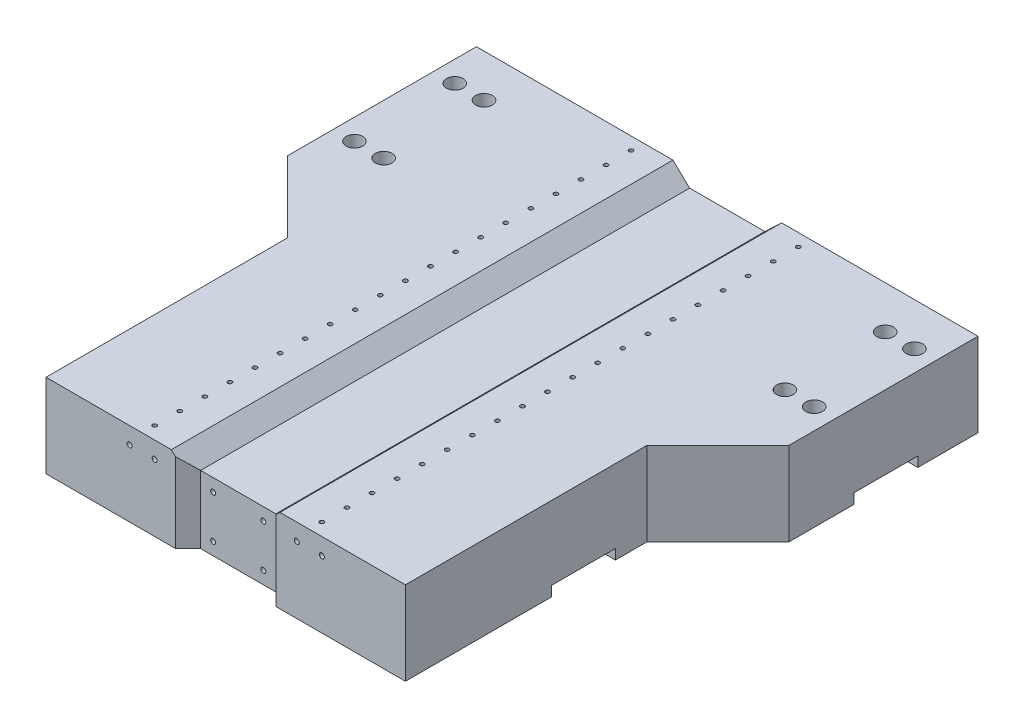
from build123d import *

# Parameters (mm, degrees)
SKETCH1_W                           = 600
SKETCH1_H                           = 600
BOSS_EXTRUDE1_DEPTH                 = 100
CUT_EXTRUDE1_DEPTH                  = 436.889894354
CHAMFER5_SIZE                       = 85
CUT_EXTRUDE2_DEPTH                  = 679.232998313
SKETCH9_R                           = 10
CUT_EXTRUDE5_DEPTH                  = 436.889894354
SKETCH12_R                          = 2.5
CUT_EXTRUDE7_DEPTH                  = 30
SKETCH14_W                          = 90
SKETCH14_H                          = 15
CUT_EXTRUDE8_DEPTH                  = 432.927077179
CHAMFER3_SIZE                       = 15
SKETCH15_W                          = 76.2
SKETCH15_H                          = 12.7
CUT_EXTRUDE9_DEPTH                  = 679.232998313
F_6_0MM_DOWEL_HOLE1_D               = 6
F_6_0MM_DOWEL_HOLE1_DEPTH           = 30
F_6_0MM_DOWEL_HOLE1_TIP             = 1.802581857
F_6_0MM_DOWEL_HOLE1_ON_FACE_2_D     = 6
F_6_0MM_DOWEL_HOLE1_ON_FACE_2_DEPTH = 30
F_6_0MM_DOWEL_HOLE1_ON_FACE_2_TIP   = 1.802581857
F_6_0MM_DOWEL_HOLE1_ON_FACE_3_D     = 6
F_6_0MM_DOWEL_HOLE1_ON_FACE_3_DEPTH = 30
F_6_0MM_DOWEL_HOLE1_ON_FACE_3_TIP   = 1.802581857


with BuildPart() as part:
    # Sketch1 → Boss-Extrude1 (new body)
    with BuildSketch(Plane(origin=(0, 0, 0), x_dir=(1, 0, 0), z_dir=(0, 1, 0))):
        Rectangle(SKETCH1_W, SKETCH1_H)
    extrude(amount=BOSS_EXTRUDE1_DEPTH)

    # Sketch2 → Cut-Extrude1 (cut, through all)
    with BuildSketch(Plane(origin=(0, 100, 0), x_dir=(1, 0, 0), z_dir=(0, 1, 0))):
        Polygon((-300, -300), (-220, -300), (-215, -300), (-215, 74), (-220, 74), (-300, 74), (-300, 60), align=None)
        Polygon((300, -300), (220, -300), (215, -300), (215, 74), (220, 74), (300, 74), (300, 60), align=None)
    extrude(amount=-CUT_EXTRUDE1_DEPTH, mode=Mode.SUBTRACT)

    # Chamfer5
    chamfer5_edges = [part.edges().sort_by_distance(p)[0] for p in [
        (-215, 50, -74),
        (215, 50, -74),
    ]]
    chamfer(chamfer5_edges, length=CHAMFER5_SIZE - 0.0001)  # a hair under: the kernel refuses the full size

    # Sketch3 → Cut-Extrude2 (cut, through all)
    with BuildSketch(Plane.XY.offset(300)):
        Polygon((-35, 81), (-45, 81), (-65, 100), (-45, 100), (45, 100), (65, 100), (45, 81), (35, 81), (0, 81), align=None)
    extrude(amount=-CUT_EXTRUDE2_DEPTH, mode=Mode.SUBTRACT)

    # Sketch9 → Cut-Extrude5 (cut, through all)
    with BuildSketch(Plane(origin=(0, 100, 0), x_dir=(1, 0, 0), z_dir=(0, 1, 0))):
        with Locations(Location((275, 129, 0), (0, 0, 270))):
            Circle(SKETCH9_R)
        with Locations(Location((240, 129, 0), (0, 0, 270))):
            Circle(SKETCH9_R)
        with Locations(Location((240, 249, 0), (0, 0, 270))):
            Circle(SKETCH9_R)
        with Locations(Location((275, 249, 0), (0, 0, 270))):
            Circle(SKETCH9_R)
        with Locations(Location((-275, 129, 0), (0, 0, 90))):
            Circle(SKETCH9_R)
        with Locations(Location((-240, 249, 0), (0, 0, 90))):
            Circle(SKETCH9_R)
        with Locations(Location((-275, 249, 0), (0, 0, 90))):
            Circle(SKETCH9_R)
        with Locations(Location((-240, 129, 0), (0, 0, 90))):
            Circle(SKETCH9_R)
    extrude(amount=-CUT_EXTRUDE5_DEPTH, mode=Mode.SUBTRACT)

    # Sketch12 → Cut-Extrude7 (cut)
    with BuildSketch(Plane(origin=(0, 100, 0), x_dir=(1, 0, 0), z_dir=(0, 1, 0))):
        with Locations(Location((-100, -285, 0), (0, 0, 270))):
            Circle(SKETCH12_R)
        with Locations(Location((100, -285, 0), (0, 0, 270))):
            Circle(SKETCH12_R)
        with Locations(Location((100, -255, 0), (0, 0, 270))):
            Circle(SKETCH12_R)
        with Locations(Location((100, -225, 0), (0, 0, 270))):
            Circle(SKETCH12_R)
        with Locations(Location((100, -195, 0), (0, 0, 270))):
            Circle(SKETCH12_R)
        with Locations(Location((100, -165, 0), (0, 0, 270))):
            Circle(SKETCH12_R)
        with Locations(Location((100, -135, 0), (0, 0, 270))):
            Circle(SKETCH12_R)
        with Locations(Location((100, -105, 0), (0, 0, 270))):
            Circle(SKETCH12_R)
        with Locations(Location((100, -75, 0), (0, 0, 270))):
            Circle(SKETCH12_R)
        with Locations(Location((100, -45, 0), (0, 0, 270))):
            Circle(SKETCH12_R)
        with Locations(Location((100, -15, 0), (0, 0, 270))):
            Circle(SKETCH12_R)
        with Locations(Location((100, 15, 0), (0, 0, 270))):
            Circle(SKETCH12_R)
        with Locations(Location((100, 45, 0), (0, 0, 270))):
            Circle(SKETCH12_R)
        with Locations(Location((100, 75, 0), (0, 0, 270))):
            Circle(SKETCH12_R)
        with Locations(Location((100, 105, 0), (0, 0, 270))):
            Circle(SKETCH12_R)
        with Locations(Location((100, 135, 0), (0, 0, 270))):
            Circle(SKETCH12_R)
        with Locations(Location((100, 165, 0), (0, 0, 270))):
            Circle(SKETCH12_R)
        with Locations(Location((100, 195, 0), (0, 0, 270))):
            Circle(SKETCH12_R)
        with Locations(Location((100, 225, 0), (0, 0, 270))):
            Circle(SKETCH12_R)
        with Locations(Location((100, 255, 0), (0, 0, 270))):
            Circle(SKETCH12_R)
        with Locations(Location((100, 285, 0), (0, 0, 270))):
            Circle(SKETCH12_R)
        with Locations(Location((-100, -255, 0), (0, 0, 270))):
            Circle(SKETCH12_R)
        with Locations(Location((-100, -225, 0), (0, 0, 270))):
            Circle(SKETCH12_R)
        with Locations(Location((-100, -195, 0), (0, 0, 270))):
            Circle(SKETCH12_R)
        with Locations(Location((-100, -165, 0), (0, 0, 270))):
            Circle(SKETCH12_R)
        with Locations(Location((-100, -135, 0), (0, 0, 270))):
            Circle(SKETCH12_R)
        with Locations(Location((-100, -105, 0), (0, 0, 270))):
            Circle(SKETCH12_R)
        with Locations(Location((-100, -75, 0), (0, 0, 270))):
            Circle(SKETCH12_R)
        with Locations(Location((-100, -45, 0), (0, 0, 270))):
            Circle(SKETCH12_R)
        with Locations(Location((-100, -15, 0), (0, 0, 270))):
            Circle(SKETCH12_R)
        with Locations(Location((-100, 15, 0), (0, 0, 270))):
            Circle(SKETCH12_R)
        with Locations(Location((-100, 45, 0), (0, 0, 270))):
            Circle(SKETCH12_R)
        with Locations(Location((-100, 75, 0), (0, 0, 270))):
            Circle(SKETCH12_R)
        with Locations(Location((-100, 105, 0), (0, 0, 270))):
            Circle(SKETCH12_R)
        with Locations(Location((-100, 135, 0), (0, 0, 270))):
            Circle(SKETCH12_R)
        with Locations(Location((-100, 165, 0), (0, 0, 270))):
            Circle(SKETCH12_R)
        with Locations(Location((-100, 195, 0), (0, 0, 270))):
            Circle(SKETCH12_R)
        with Locations(Location((-100, 225, 0), (0, 0, 270))):
            Circle(SKETCH12_R)
        with Locations(Location((-100, 255, 0), (0, 0, 270))):
            Circle(SKETCH12_R)
        with Locations(Location((-100, 285, 0), (0, 0, 270))):
            Circle(SKETCH12_R)
    extrude(amount=-CUT_EXTRUDE7_DEPTH, mode=Mode.SUBTRACT)

    # Sketch14 → Cut-Extrude8 (cut, through all)
    with BuildSketch(Plane(origin=(0, 81, 0), x_dir=(1, 0, 0), z_dir=(0, 1, 0))):
        with Locations((0, -292.5)):
            Rectangle(SKETCH14_W, SKETCH14_H)
    extrude(amount=-CUT_EXTRUDE8_DEPTH, mode=Mode.SUBTRACT)

    # Chamfer3
    chamfer3_edges = [part.edges().sort_by_distance(p)[0] for p in [
        (45, 40.5, 300),
        (-45, 40.5, 300),
    ]]
    chamfer(chamfer3_edges, length=CHAMFER3_SIZE - 0.0001)  # a hair under: the kernel refuses the full size

    # Sketch15 → Cut-Extrude9 (cut, through all)
    with BuildSketch(Plane.ZY.offset(300)):
        with Locations((86.9, 5.65)):
            Rectangle(SKETCH15_W, SKETCH15_H)
        with Locations((-189.9, 5.65)):
            Rectangle(SKETCH15_W, SKETCH15_H)
    extrude(amount=-CUT_EXTRUDE9_DEPTH, mode=Mode.SUBTRACT)

    # Ø6.0mm Dowel Hole1
    with Locations(Plane(origin=(-30, 66, 285), x_dir=(1, 0, 0), z_dir=(0, 0, 1))):
        with Locations((0, 0), (60, 0), (60, -51), (0, -51)):
            Hole(F_6_0MM_DOWEL_HOLE1_D / 2, depth=F_6_0MM_DOWEL_HOLE1_DEPTH)
            with Locations((0, 0, -(F_6_0MM_DOWEL_HOLE1_DEPTH + F_6_0MM_DOWEL_HOLE1_TIP / 2))):  # 118° drill point
                Cone(0, F_6_0MM_DOWEL_HOLE1_D / 2, F_6_0MM_DOWEL_HOLE1_TIP, mode=Mode.SUBTRACT)

    # Ø6.0mm Dowel Hole1 on face 2
    with Locations(Plane(origin=(30, 66, -300), x_dir=(-1, 0, 0), z_dir=(0, 0, -1))):
        with Locations((0, 0), (60, 0), (60, -51), (0, -51), (145, 14), (115, 14), (-55, 14), (-85, 14)):
            Hole(F_6_0MM_DOWEL_HOLE1_ON_FACE_2_D / 2, depth=F_6_0MM_DOWEL_HOLE1_ON_FACE_2_DEPTH)
            with Locations((0, 0, -(F_6_0MM_DOWEL_HOLE1_ON_FACE_2_DEPTH + F_6_0MM_DOWEL_HOLE1_ON_FACE_2_TIP / 2))):  # 118° drill point
                Cone(0, F_6_0MM_DOWEL_HOLE1_ON_FACE_2_D / 2, F_6_0MM_DOWEL_HOLE1_ON_FACE_2_TIP, mode=Mode.SUBTRACT)

    # Ø6.0mm Dowel Hole1 on face 3
    with Locations(Plane(origin=(-85, 80, 300), x_dir=(1, 0, 0), z_dir=(0, 0, 1))):
        with Locations((0, 0), (-30, 0), (170, 0), (200, 0)):
            Hole(F_6_0MM_DOWEL_HOLE1_ON_FACE_3_D / 2, depth=F_6_0MM_DOWEL_HOLE1_ON_FACE_3_DEPTH)
            with Locations((0, 0, -(F_6_0MM_DOWEL_HOLE1_ON_FACE_3_DEPTH + F_6_0MM_DOWEL_HOLE1_ON_FACE_3_TIP / 2))):  # 118° drill point
                Cone(0, F_6_0MM_DOWEL_HOLE1_ON_FACE_3_D / 2, F_6_0MM_DOWEL_HOLE1_ON_FACE_3_TIP, mode=Mode.SUBTRACT)


solid = part.part
